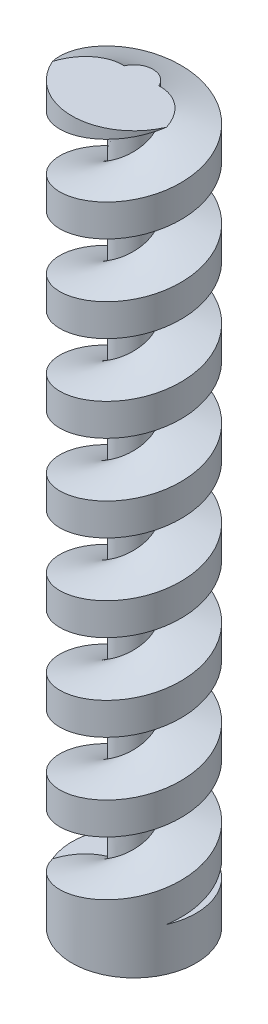
from build123d import *

# Parameters (mm, degrees)
SKETCH1_R           = 9.128125
BOSS_EXTRUDE1_DEPTH = 9.525
SKETCH1_3_R         = 9.128125
BOSS_EXTRUDE2_DEPTH = 101.6
CUT_SWEEP2_PITCH    = 12.7
BOSS_EXTRUDE3_START = 6.35
SKETCH6_R           = 9.128125
BOSS_EXTRUDE3_DEPTH = 6.35
CUT_EXTRUDE1_DEPTH  = 5.55625


with BuildPart() as part:
    # Sketch1 → Boss-Extrude1 (new body)
    with BuildSketch(Plane(origin=(0, 0, 0), x_dir=(1, 0, 0), z_dir=(0, 1, 0))):
        with Locations(Location((0, 0, 0), (0, 0, 90))):
            Circle(SKETCH1_R)
    extrude(amount=BOSS_EXTRUDE1_DEPTH)

    # Sketch1<3> → Boss-Extrude2 (add)
    with BuildSketch(Plane(origin=(0, 0, 0), x_dir=(1, 0, 0), z_dir=(0, 1, 0))):
        with Locations(Location((0, 0, 0), (0, 0, 90))):
            Circle(SKETCH1_3_R)
    extrude(amount=BOSS_EXTRUDE2_DEPTH)

    # Cut-Sweep2: arcs per turn and ends read off the stored shape
    # Cut-Sweep2: the profile of Sketch4 profile screwed along a right-hand helix through 11 turns, 18 arcs to a turn; built about Z, then put on its axis
    cut_sweep2_z = Axis((0, 0, 0), (0, 0, 1))
    cut_sweep2_corners = [(2.778125, 0, -10.346055), (9.128425, 0, -8.703644087), (9.128425, 0, -16.69613258), (2.778125, 0, -15.053945)]
    with BuildLine(mode=Mode.PRIVATE) as cut_sweep2_profile:
        Line(cut_sweep2_corners[0], cut_sweep2_corners[1])
        Line(cut_sweep2_corners[1], cut_sweep2_corners[2])
        Line(cut_sweep2_corners[2], cut_sweep2_corners[3])
        Line(cut_sweep2_corners[3], cut_sweep2_corners[0])
    cut_sweep2_cap = Face(cut_sweep2_profile.wire())
    cut_sweep2_turn_angles = [0, 10, 20, 30, 40, 50, 60, 70, 80, 90, 100, 110, 120, 130, 140, 150, 160, 170, 180, 190, 200, 210, 220, 230, 240, 250, 260, 270, 280, 290, 300, 310, 320, 330, 340, 350, 360]
    cut_sweep2_turn_weights = [1, 0.984807753012208, 1, 0.984807753012208, 1, 0.984807753012208, 1, 0.984807753012208, 1, 0.984807753012208, 1, 0.984807753012208, 1, 0.984807753012208, 1, 0.984807753012208, 1, 0.984807753012208, 1, 0.984807753012208, 1, 0.984807753012208, 1, 0.984807753012208, 1, 0.984807753012208, 1, 0.984807753012208, 1, 0.984807753012208, 1, 0.984807753012208, 1, 0.984807753012208, 1, 0.984807753012208, 1]
    cut_sweep2_turn_rails = [Edge.make_bspline([Vector(p[0], p[1], 0).rotate(cut_sweep2_z, cut_sweep2_turn_angles[k]) / cut_sweep2_turn_weights[k] + Vector(0, 0, p[2] + CUT_SWEEP2_PITCH * cut_sweep2_turn_angles[k] / 360) for k in range(37)], [0, 0, 0, 1, 1, 2, 2, 3, 3, 4, 4, 5, 5, 6, 6, 7, 7, 8, 8, 9, 9, 10, 10, 11, 11, 12, 12, 13, 13, 14, 14, 15, 15, 16, 16, 17, 17, 18, 18, 18], 2, cut_sweep2_turn_weights) for p in cut_sweep2_corners]
    cut_sweep2_turn_sides = [Face.make_surface_from_curves(cut_sweep2_turn_rails[p[0]], cut_sweep2_turn_rails[p[1]]) for p in [(0, 1), (1, 2), (2, 3), (3, 0)]]
    cut_sweep2 = Plane(origin=(0, 0, 0), x_dir=(0, 0, -1), z_dir=(0, 1, 0)) * Solid(Shell([*[p.moved(Location((0, 0, CUT_SWEEP2_PITCH * i))) for i in range(11) for p in cut_sweep2_turn_sides], cut_sweep2_cap, cut_sweep2_cap.rotate(cut_sweep2_z, 3960).moved(Location((0, 0, CUT_SWEEP2_PITCH * 3960 / 360)))]))
    add(cut_sweep2, mode=Mode.SUBTRACT)

    # Sketch6 → Boss-Extrude3 (add)
    with BuildSketch(Plane.XZ.offset(BOSS_EXTRUDE3_START)):
        with Locations(Location((0, 0, 0), (0, 0, 270))):
            Circle(SKETCH6_R)
    extrude(amount=-BOSS_EXTRUDE3_DEPTH)

    # Sketch2 → Cut-Extrude1 (cut)
    with BuildSketch(Plane.XZ.offset(6.35)):
        with BuildLine():
            ThreePointArc((1.5, 2), (0, 2.5), (-1.5, 2))
            Line((-1.5, 2), (-1.5, -2))
            ThreePointArc((-1.5, -2), (0, -2.5), (1.5, -2))
            Line((1.5, -2), (1.5, 2))
        make_face()
    extrude(amount=-CUT_EXTRUDE1_DEPTH, mode=Mode.SUBTRACT)


solid = part.part
